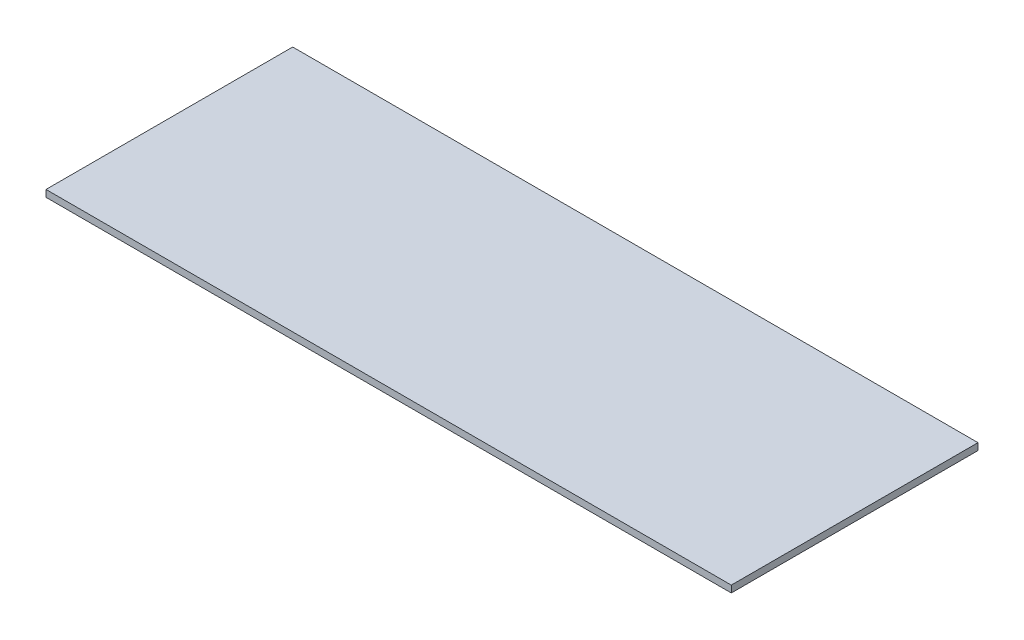
from build123d import *

# Parameters (mm, degrees)
SKETCH1_W           = 635
SKETCH1_H           = 228.6
BOSS_EXTRUDE1_DEPTH = 6.35


with BuildPart() as part:
    # Sketch1 → Boss-Extrude1 (new body)
    with BuildSketch(Plane(origin=(0, 0, 0), x_dir=(1, 0, 0), z_dir=(0, 1, 0))):
        Rectangle(SKETCH1_W, SKETCH1_H)
    extrude(amount=BOSS_EXTRUDE1_DEPTH)


solid = part.part
